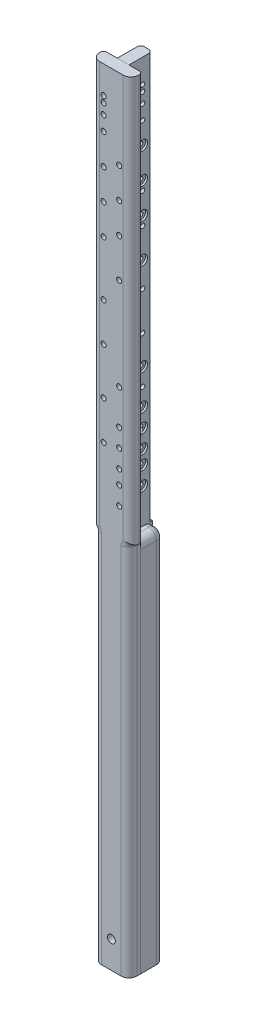
from build123d import *

# Parameters (mm, degrees)
SKETCH1_W            = 19.05
SKETCH1_H            = 1270
BOSS_EXTRUDE1_DEPTH  = 31.75
SKETCH8_W            = 38.1
SKETCH8_H            = 1270
BOSS_EXTRUDE2_DEPTH  = 9.525
SKETCH11_W           = 38.1
SKETCH11_H           = 609.6
BOSS_EXTRUDE3_DEPTH  = 19.05
SKETCH12_W           = 38.1
SKETCH12_H           = 609.6
BOSS_EXTRUDE4_DEPTH  = 19.05
SKETCH13_W           = 3.175
SKETCH13_H           = 609.6
CUT_EXTRUDE5_DEPTH   = 637.93380543
FILLET1_R            = 3.175
CHAMFER3_SIZE        = 3.81
FILLET3_R            = 12.7
FILLET4_R            = 12.7
FILLET5_R            = 12.7
SKETCH2_R            = 6.35
EYEBOLT_ANCHOR_DEPTH = 639.356628487
SKETCH5_R            = 1.905
CUT_EXTRUDE3_DEPTH   = 639.356628487
SKETCH6_R            = 4.1275
CUT_EXTRUDE4_DEPTH   = 7.747
CUT_EXTRUDE6_DEPTH   = 660.4
SKETCH15_R           = 7.9375
CUT_EXTRUDE7_DEPTH   = 3.175
SKETCH17_R           = 3.4925
CUT_EXTRUDE9_DEPTH   = 639.119711641
SKETCH16_R           = 7.9375
CUT_EXTRUDE8_DEPTH   = 3.175
SKETCH18_R           = 3.4925
CUT_EXTRUDE10_DEPTH  = 639.119711641


# Some blends are built 0.0001 mm under size
with BuildPart() as part:
    # Sketch1 → Boss-Extrude1 (new, symmetric)
    with BuildSketch(Plane(origin=(0, 0, 0), x_dir=(0, 0, -1), z_dir=(1, 0, 0))):
        Rectangle(SKETCH1_W, SKETCH1_H)
    extrude(amount=BOSS_EXTRUDE1_DEPTH, both=True)

    # Sketch13 → Cut-Extrude5 (cut, through all)
    with BuildSketch(Plane(origin=(0, 0, -9.525), x_dir=(-1, 0, 0), z_dir=(0, 0, -1))):
        with Locations((-30.1625, -330.2)):
            Rectangle(SKETCH13_W, SKETCH13_H)
        with Locations((30.1625, -330.2)):
            Rectangle(SKETCH13_W, SKETCH13_H)
    extrude(amount=-CUT_EXTRUDE5_DEPTH, mode=Mode.SUBTRACT)

    # Fillet1
    fillet1_edges = [part.edges().sort_by_distance(p)[0] for p in [
        (-28.575, -25.4, 0),
        (28.575, -25.4, 0),
    ]]
    fillet(fillet1_edges, radius=FILLET1_R - 0.0001)  # a hair under: the kernel refuses the full size

    # Chamfer3
    chamfer3_edges = [part.edges().sort_by_distance(p)[0] for p in [
        (-31.75, 304.8, -9.525),
        (31.75, 304.8, -9.525),
    ]]
    chamfer(chamfer3_edges, length=CHAMFER3_SIZE)

    # Fillet3
    # the kernel refuses this fillet: 12.7 mm, written as the material it takes off along each edge
    with BuildSketch(Plane(origin=(28.575, -28.5749, 9.525), x_dir=(-1, 0, 0), z_dir=(0, -1, 0))) as fillet3_piece_1:
        with BuildLine():
            CenterArc((FILLET3_R, FILLET3_R), FILLET3_R, 180, 90)
            Line((0, FILLET3_R), (0, 0))
            Line((0, 0), (FILLET3_R, 0))
        make_face()
    extrude(amount=638.1751, mode=Mode.SUBTRACT)
    with BuildSketch(Plane(origin=(-28.575, -28.5749, 9.525), x_dir=(1, 0, 0), z_dir=(0, -1, 0))) as fillet3_piece_2:
        with BuildLine():
            CenterArc((FILLET3_R, -FILLET3_R), FILLET3_R, 90, 90)
            Line((0, -FILLET3_R), (0, 0))
            Line((0, 0), (FILLET3_R, 0))
        make_face()
    extrude(amount=638.1751, mode=Mode.SUBTRACT)
    with BuildSketch(Plane(origin=(-31.7499, -28.5749, 9.525), x_dir=(0, 1, 0), z_dir=(-1, 0, 0))) as fillet3_piece_3:
        with BuildLine():
            CenterArc((3.1749 + FILLET3_R, FILLET3_R), FILLET3_R, 180, 90)
            Line((3.1749, FILLET3_R), (3.1749, 0))
            Line((3.1749, 0), (3.1749 + FILLET3_R, 0))
        make_face()
    revolve(axis=Axis((-31.7499, -28.5749, 9.525), (0, 0, -1)), revolution_arc=90, mode=Mode.SUBTRACT)
    with BuildSketch(Plane(origin=(31.7499, -28.5749, 9.525), x_dir=(0, 1, 0), z_dir=(1, 0, 0))) as fillet3_piece_4:
        with BuildLine():
            CenterArc((3.1749 + FILLET3_R, -FILLET3_R), FILLET3_R, 90, 90)
            Line((3.1749 + FILLET3_R, 0), (3.1749, 0))
            Line((3.1749, 0), (3.1749, -FILLET3_R))
        make_face()
    revolve(axis=Axis((31.7499, -28.5749, 9.525), (0, 0, 1)), revolution_arc=90, mode=Mode.SUBTRACT)
    with BuildSketch(Plane(origin=(31.75, 666.75, 9.525), x_dir=(-1, 0, 0), z_dir=(0, -1, 0))) as fillet3_piece_5:
        with BuildLine():
            CenterArc((FILLET3_R, FILLET3_R), FILLET3_R, 180, 90)
            Line((0, FILLET3_R), (0, 0))
            Line((0, 0), (FILLET3_R, 0))
        make_face()
    extrude(amount=723.9, mode=Mode.SUBTRACT)
    with BuildSketch(Plane(origin=(-31.75, 666.75, 9.525), x_dir=(1, 0, 0), z_dir=(0, -1, 0))) as fillet3_piece_6:
        with BuildLine():
            CenterArc((FILLET3_R, -FILLET3_R), FILLET3_R, 90, 90)
            Line((0, -FILLET3_R), (0, 0))
            Line((0, 0), (FILLET3_R, 0))
        make_face()
    extrude(amount=723.9, mode=Mode.SUBTRACT)
    with BuildSketch(Plane(origin=(63.5, -25.4, 9.525), x_dir=(0, 0, -1), z_dir=(-1, 0, 0)), Plane(origin=(-63.5, -25.4, 9.525), x_dir=(0, 1, 0), z_dir=(1, 0, 0))) as fillet3_piece_7:
        with BuildLine():
            CenterArc((FILLET3_R, -FILLET3_R), FILLET3_R, 90, 90)
            Line((0, -FILLET3_R), (0, 0))
            Line((0, 0), (FILLET3_R, 0))
        make_face()
    extrude(amount=31.7501, mode=Mode.SUBTRACT)


with BuildPart() as body_2:
    # Sketch8 → Boss-Extrude2 (new, symmetric)
    with BuildSketch(Plane(origin=(0, 0, 0), x_dir=(0, 0, -1), z_dir=(1, 0, 0))):
        with Locations((28.575, 0)):
            Rectangle(SKETCH8_W, SKETCH8_H)
    extrude(amount=BOSS_EXTRUDE2_DEPTH, both=True)


with BuildPart() as body_3:
    # Sketch11 → Boss-Extrude3 (new body)
    with BuildSketch(Plane(origin=(9.525, 0, -38.1), x_dir=(0, 0, 1), z_dir=(-1, 0, 0))):
        with Locations((9.525, -330.2)):
            Rectangle(SKETCH11_W, SKETCH11_H)
    extrude(amount=-BOSS_EXTRUDE3_DEPTH)

    # Fillet4
    fillet4_edges = [body_3.edges().sort_by_distance(p)[0] for p in [
        (28.575, -330.2, -47.625),
        (19.05, -25.4, -47.625),
        (28.575, -25.4, -28.575),
    ]]
    fillet(fillet4_edges, radius=FILLET4_R)


with BuildPart() as body_4:
    # Sketch12 → Boss-Extrude4 (new body)
    with BuildSketch(Plane(origin=(-9.525, 0, -19.05), x_dir=(0, 0, 1), z_dir=(-1, 0, 0))):
        with Locations((-9.525, -330.2)):
            Rectangle(SKETCH12_W, SKETCH12_H)
    extrude(amount=BOSS_EXTRUDE4_DEPTH)

    # Fillet5
    fillet5_edges = [body_4.edges().sort_by_distance(p)[0] for p in [
        (-28.575, -330.2, -47.625),
        (-19.05, -25.4, -47.625),
        (-28.575, -25.4, -28.575),
    ]]
    fillet(fillet5_edges, radius=FILLET5_R)


with BuildPart() as eyebolt_anchor_tool:
    # Sketch2 → eyebolt anchor (new, through all)
    with BuildSketch(Plane.XY.offset(9.525)):
        with Locations((0, -590.55)):
            Circle(SKETCH2_R)
    extrude(amount=-EYEBOLT_ANCHOR_DEPTH)


with BuildPart() as part_1:
    add(part.part)

    # eyebolt anchor: cut by eyebolt_anchor_tool
    add(eyebolt_anchor_tool.part, mode=Mode.SUBTRACT)

    # Sketch5 → Cut-Extrude3 (cut, through all)
    with BuildSketch(Plane.XY.offset(9.525)):
        with Locations((-12.7, 539.785538418)):
            Circle(SKETCH5_R)
        with Locations((12.7, 504.805819532)):
            Circle(SKETCH5_R)
        with Locations((-12.7, 490.284900702)):
            Circle(SKETCH5_R)
        with Locations((12.7, 455.324565311)):
            Circle(SKETCH5_R)
        with Locations((-12.7, 440.776867488)):
            Circle(SKETCH5_R)
        with Locations((12.7, 405.838666491)):
            Circle(SKETCH5_R)
        with Locations((-12.7, 391.259568402)):
            Circle(SKETCH5_R)
        with Locations((12.7, 343.099169637)):
            Circle(SKETCH5_R)
        with Locations((-12.7, 563.240488526)):
            Circle(SKETCH5_R)
        with Locations((-12.7, 580.095733694)):
            Circle(SKETCH5_R)
        with Locations((-12.7, 590.307211361)):
            Circle(SKETCH5_R)
        with Locations((12.7, 192.912224305)):
            Circle(SKETCH5_R)
        with Locations((12.7, 106.762447076)):
            Circle(SKETCH5_R)
        with Locations((12.7, 77.349731766)):
            Circle(SKETCH5_R)
        with Locations((12.7, 54.763315491)):
            Circle(SKETCH5_R)
        with Locations((12.7, 25.313676733)):
            Circle(SKETCH5_R)
        with Locations((12.7, 136.166887065)):
            Circle(SKETCH5_R)
        with Locations((-12.7, 102.105807019)):
            Circle(SKETCH5_R)
        with Locations((-12.7, 164.675911388)):
            Circle(SKETCH5_R)
        with Locations((-12.7, 240.248110745)):
            Circle(SKETCH5_R)
        with Locations((-12.7, 302.767153434)):
            Circle(SKETCH5_R)
    extrude(amount=-CUT_EXTRUDE3_DEPTH, mode=Mode.SUBTRACT)

    # Sketch6 → Cut-Extrude4 (cut)
    with BuildSketch(Plane.XY.offset(9.525)):
        with Locations((-12.7, 539.785538418)):
            Circle(SKETCH6_R)
        with Locations((12.7, 504.805819532)):
            Circle(SKETCH6_R)
        with Locations((-12.7, 490.284900702)):
            Circle(SKETCH6_R)
        with Locations((12.7, 455.324565311)):
            Circle(SKETCH6_R)
        with Locations((12.7, 405.838666491)):
            Circle(SKETCH6_R)
        with Locations((12.7, 343.099169637)):
            Circle(SKETCH6_R)
        with Locations((-12.7, 391.259568402)):
            Circle(SKETCH6_R)
        with Locations((-12.7, 440.776867488)):
            Circle(SKETCH6_R)
        with Locations((-12.7, 590.307211361)):
            Circle(SKETCH6_R)
        with Locations((-12.7, 580.095733694)):
            Circle(SKETCH6_R)
        with Locations((-12.7, 563.240488526)):
            Circle(SKETCH6_R)
        with Locations((-12.7, 302.767153434)):
            Circle(SKETCH6_R)
        with Locations((-12.7, 240.248110745)):
            Circle(SKETCH6_R)
        with Locations((12.7, 192.912224305)):
            Circle(SKETCH6_R)
        with Locations((-12.7, 164.675911388)):
            Circle(SKETCH6_R)
        with Locations((12.7, 106.762447076)):
            Circle(SKETCH6_R)
        with Locations((12.7, 77.349731766)):
            Circle(SKETCH6_R)
        with Locations((-12.7, 102.105807019)):
            Circle(SKETCH6_R)
        with Locations((12.7, 54.763315491)):
            Circle(SKETCH6_R)
        with Locations((12.7, 25.313676733)):
            Circle(SKETCH6_R)
        with Locations((12.7, 136.166887065)):
            Circle(SKETCH6_R)
    extrude(amount=-CUT_EXTRUDE4_DEPTH, mode=Mode.SUBTRACT)


with BuildPart() as body_2_1:
    add(body_2.part)

    # eyebolt anchor: cut by eyebolt_anchor_tool
    add(eyebolt_anchor_tool.part, mode=Mode.SUBTRACT)

    # Sketch14 → Cut-Extrude6 (cut)
    with BuildSketch(Plane(origin=(0, 635, 0), x_dir=(1, 0, 0), z_dir=(0, 1, 0))):
        Polygon((-5.715, 47.625), (-9.525, 47.625), (-9.525, 43.815), align=None)
        Polygon((9.525, 43.815), (5.715, 47.625), (9.525, 47.625), align=None)
    extrude(amount=-CUT_EXTRUDE6_DEPTH, mode=Mode.SUBTRACT)

    # Sketch15 → Cut-Extrude7 (cut)
    with BuildSketch(Plane(origin=(9.525, 0, 0), x_dir=(0, 0, -1), z_dir=(1, 0, 0))):
        with Locations((31.75, 510.760990334)):
            Circle(SKETCH15_R)
        with Locations((31.75, 461.279736113)):
            Circle(SKETCH15_R)
        with Locations((31.75, 411.793837293)):
            Circle(SKETCH15_R)
        with Locations((31.75, 349.054340439)):
            Circle(SKETCH15_R)
        with Locations((31.75, 198.867395107)):
            Circle(SKETCH15_R)
        with Locations((31.75, 112.717617878)):
            Circle(SKETCH15_R)
        with Locations((31.75, 83.304902568)):
            Circle(SKETCH15_R)
        with Locations((31.75, 60.718486293)):
            Circle(SKETCH15_R)
        with Locations((31.75, 31.268847535)):
            Circle(SKETCH15_R)
        with Locations((31.75, 142.122057867)):
            Circle(SKETCH15_R)
    extrude(amount=-CUT_EXTRUDE7_DEPTH, mode=Mode.SUBTRACT)

    # Sketch17 → Cut-Extrude9 (cut, through all)
    with BuildSketch(Plane(origin=(9.525, 0, 0), x_dir=(0, 0, -1), z_dir=(1, 0, 0))):
        with Locations((31.75, 510.760990334)):
            Circle(SKETCH17_R)
        with Locations((31.75, 461.279736113)):
            Circle(SKETCH17_R)
        with Locations((31.75, 411.793837293)):
            Circle(SKETCH17_R)
        with Locations((31.75, 349.054340439)):
            Circle(SKETCH17_R)
        with Locations((31.75, 198.867395107)):
            Circle(SKETCH17_R)
        with Locations((31.75, 112.717617878)):
            Circle(SKETCH17_R)
        with Locations((31.75, 83.304902568)):
            Circle(SKETCH17_R)
        with Locations((31.75, 60.718486293)):
            Circle(SKETCH17_R)
        with Locations((31.75, 31.268847535)):
            Circle(SKETCH17_R)
        with Locations((31.75, 142.122057867)):
            Circle(SKETCH17_R)
    extrude(amount=-CUT_EXTRUDE9_DEPTH, mode=Mode.SUBTRACT)

    # Sketch16 → Cut-Extrude8 (cut)
    with BuildSketch(Plane.ZY.offset(9.525)):
        with Locations((-31.75, 108.060977821)):
            Circle(SKETCH16_R)
        with Locations((-31.75, 170.63108219)):
            Circle(SKETCH16_R)
        with Locations((-31.75, 246.203281547)):
            Circle(SKETCH16_R)
        with Locations((-31.75, 308.722324236)):
            Circle(SKETCH16_R)
        with Locations((-31.75, 397.214739203)):
            Circle(SKETCH16_R)
        with Locations((-31.75, 446.732038289)):
            Circle(SKETCH16_R)
        with Locations((-31.75, 545.74070922)):
            Circle(SKETCH16_R)
        with Locations((-31.75, 569.195659328)):
            Circle(SKETCH16_R)
        with Locations((-31.75, 596.262382163)):
            Circle(SKETCH16_R)
        with Locations((-31.75, 586.050904496)):
            Circle(SKETCH16_R)
    extrude(amount=-CUT_EXTRUDE8_DEPTH, mode=Mode.SUBTRACT)

    # Sketch18 → Cut-Extrude10 (cut, through all)
    with BuildSketch(Plane.ZY.offset(9.525)):
        with Locations((-31.75, 596.262382163)):
            Circle(SKETCH18_R)
        with Locations((-31.75, 586.050904496)):
            Circle(SKETCH18_R)
        with Locations((-31.75, 569.195659328)):
            Circle(SKETCH18_R)
        with Locations((-31.75, 545.74070922)):
            Circle(SKETCH18_R)
        with Locations((-31.75, 446.732038289)):
            Circle(SKETCH18_R)
        with Locations((-31.75, 397.214739203)):
            Circle(SKETCH18_R)
        with Locations((-31.75, 308.722324236)):
            Circle(SKETCH18_R)
        with Locations((-31.75, 246.203281547)):
            Circle(SKETCH18_R)
        with Locations((-31.75, 170.63108219)):
            Circle(SKETCH18_R)
        with Locations((-31.75, 108.060977821)):
            Circle(SKETCH18_R)
    extrude(amount=-CUT_EXTRUDE10_DEPTH, mode=Mode.SUBTRACT)


solid = Compound([body_3.part, body_4.part, part_1.part, body_2_1.part])
